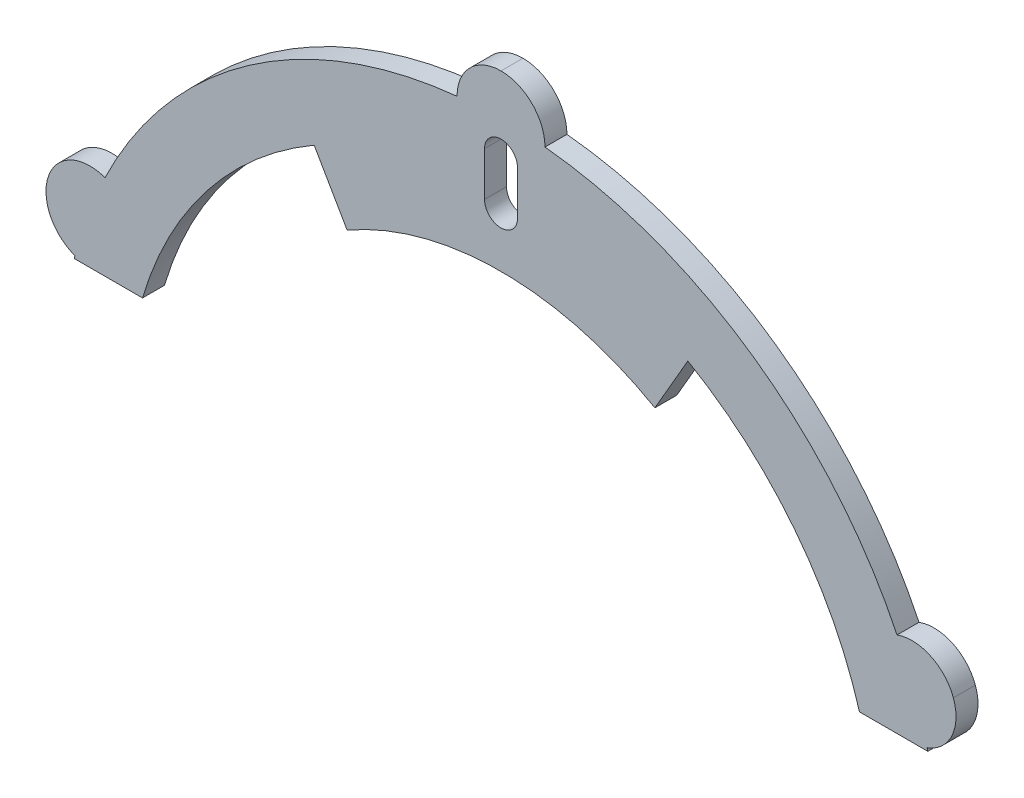
from build123d import *

# Parameters (mm, degrees)
BOSS_EXTRUDE1_DEPTH     = 6.35
FILLET1_R               = 12.7
CUT_EXTRUDE1_DEPTH      = 192.457982885
CUT_EXTRUDE1_DEPTH_BACK = 192.457982885


with BuildPart() as part:
    # Sketch1 → Boss-Extrude1 (new body)
    with BuildSketch(Plane.XY):
        with BuildLine():
            Line((-12.7, 126.363404513), (-12.7, 139.063404513))
            Line((-12.7, 139.063404513), (12.7, 139.063404513))
            Line((12.7, 139.063404513), (12.7, 126.363404513))
            ThreePointArc((12.7, 126.363404513), (72.844207417, 104.032309625), (114.399102938, 55.152926006))
            Line((114.399102938, 55.152926006), (126.333199222, 59.496581827))
            Line((126.333199222, 59.496581827), (135.020510862, 35.628389259))
            Line((135.020510862, 35.628389259), (123.086414578, 31.284733439))
            ThreePointArc((123.086414578, 31.284733439), (123.187942798, 30.882531456), (123.288156771, 30.48))
            Line((123.288156771, 30.48), (103.55757867, 30.48))
            ThreePointArc((103.55757867, 30.48), (84.832852027, 66.757694065), (53.975, 93.487442339))
            Line((53.975, 93.487442339), (44.45, 76.989658396))
            ThreePointArc((44.45, 76.989658396), (0, 88.9), (-44.45, 76.989658396))
            Line((-44.45, 76.989658396), (-53.975, 93.487442339))
            ThreePointArc((-53.975, 93.487442339), (-84.832852027, 66.757694065), (-103.55757867, 30.48))
            Line((-103.55757867, 30.48), (-123.288156771, 30.48))
            ThreePointArc((-123.288156771, 30.48), (-123.187942798, 30.882531456), (-123.086414578, 31.284733439))
            Line((-123.086414578, 31.284733439), (-135.020510862, 35.628389259))
            Line((-135.020510862, 35.628389259), (-126.333199222, 59.496581827))
            Line((-126.333199222, 59.496581827), (-114.399102938, 55.152926006))
            ThreePointArc((-114.399102938, 55.152926006), (-72.844207417, 104.032309625), (-12.7, 126.363404513))
        make_face()
    extrude(amount=BOSS_EXTRUDE1_DEPTH)

    # Fillet1
    fillet1_edges = [part.edges().sort_by_distance(p)[0] for p in [
        (135.020510862, 35.628389259, 3.175),
        (126.333199222, 59.496581827, 3.175),
        (-135.020510862, 35.628389259, 3.175),
        (-126.333199222, 59.496581827, 3.175),
        (-12.7, 139.063404513, 3.175),
        (12.7, 139.063404513, 3.175),
    ]]
    fillet(fillet1_edges, radius=FILLET1_R - 0.0001)  # a hair under: the kernel refuses the full size

    # Sketch2 → Cut-Extrude1 (cut, two sides: drawn at the far end of the back side and taken through both)
    with BuildSketch(Plane.XY.offset(6.35).offset(-CUT_EXTRUDE1_DEPTH_BACK)):
        with BuildLine():
            Line((-4.762498, 104.541870481), (-4.762498, 117.241865148))
            ThreePointArc((-4.762498, 117.241865148), (0.002182277, 122.000000094), (4.7625, 117.237500594))
            Line((4.7625, 117.237500594), (4.7625, 104.537500594))
            ThreePointArc((4.7625, 104.537500594), (-0.002184944, 99.77500109), (-4.762498, 104.541870481))
        make_face()
    extrude(amount=CUT_EXTRUDE1_DEPTH + CUT_EXTRUDE1_DEPTH_BACK, mode=Mode.SUBTRACT)


solid = part.part
